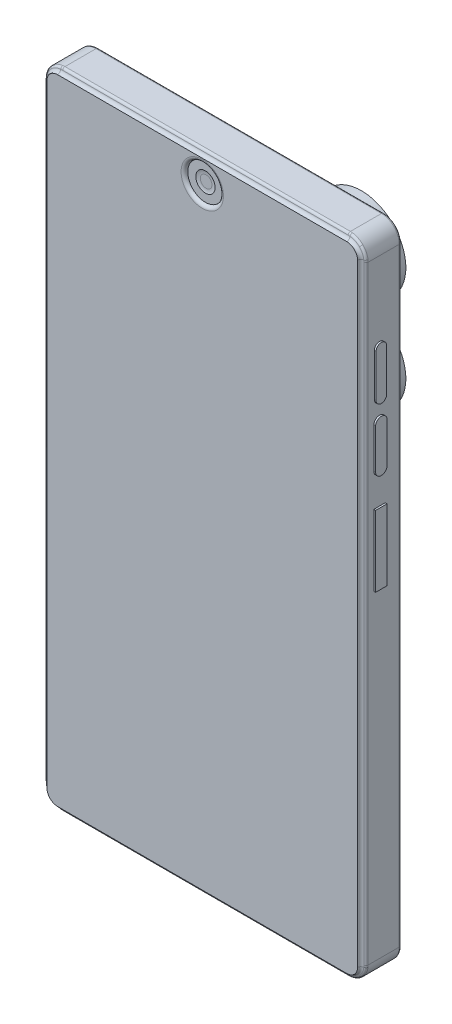
from build123d import *

# Parameters (mm, degrees)
SKETCH1_W           = 90.237490552
SKETCH1_H           = 181.084693878
BOSS_EXTRUDE1_DEPTH = 10
FILLET1_R           = 5
CUT_EXTRUDE3_DEPTH  = 1
SKETCH3_R           = 5
SKETCH3_R_2         = 12.5
SKETCH3_R_3         = 8.56802746
BOSS_EXTRUDE2_DEPTH = 4
SKETCH4_R           = 2.900185943
CUT_EXTRUDE4_DEPTH  = 1
SKETCH5_R           = 12
CUT_EXTRUDE5_DEPTH  = 1
SKETCH6_R           = 8.334390311
SKETCH6_R_2         = 6.081755444
CUT_EXTRUDE7_DEPTH  = 3
SKETCH8_W           = 87.308558364
SKETCH8_H           = 178.15576169
BOSS_EXTRUDE3_DEPTH = 0.9
FILLET2_R           = 3
SKETCH9_R           = 4.957770877
CUT_EXTRUDE8_DEPTH  = 0.9
SKETCH10_W          = 3.235977558
SKETCH10_H          = 19.955194939
BOSS_EXTRUDE4_DEPTH = 0.5
BOSS_EXTRUDE5_DEPTH = 0.5
SKETCH12_R          = 0.637732123
CUT_EXTRUDE9_DEPTH  = 6.5
SKETCH13_R          = 2.989908486
CUT_EXTRUDE10_DEPTH = 15.5
SKETCH18_R          = 2.716365736
CUT_EXTRUDE12_DEPTH = 0.2
FILLET4_R           = 3
FILLET5_R           = 1
FILLET6_R           = 1
FILLET7_R           = 1
FILLET8_R           = 1
FILLET9_R           = 1
FILLET10_R          = 1
FILLET11_R          = 1
FILLET12_R          = 1
FILLET13_R          = 1
FILLET15_R          = 0.65


# Some blends are built 0.0001 mm under size
with BuildPart() as part:
    # Sketch1 → Boss-Extrude1 (new body)
    with BuildSketch(Plane.XY):
        Rectangle(SKETCH1_W, SKETCH1_H)
    extrude(amount=BOSS_EXTRUDE1_DEPTH)

    # Fillet1
    fillet1_edges = [part.edges().sort_by_distance(p)[0] for p in [
        (45.118745276, -90.542346939, 5),
        (-45.118745276, -90.542346939, 5),
        (-45.118745276, 90.542346939, 5),
        (45.118745276, 90.542346939, 5),
    ]]
    fillet(fillet1_edges, radius=FILLET1_R)

    # Sketch2 → Cut-Extrude3 (cut)
    with BuildSketch(Plane(origin=(0, 0, 0), x_dir=(-1, 0, 0), z_dir=(0, 0, -1))):
        with BuildLine():
            Line((-16.762311283, 76.140668202), (-16.762311283, 22.728557672))
            ThreePointArc((-16.762311283, 22.728557672), (-29.831231945, 9.659637011), (-42.900152607, 22.728557672))
            Line((-42.900152607, 22.728557672), (-42.900152607, 76.140668202))
            ThreePointArc((-42.900152607, 76.140668202), (-29.831231945, 89.209588864), (-16.762311283, 76.140668202))
        make_face()
    extrude(amount=-CUT_EXTRUDE3_DEPTH, mode=Mode.SUBTRACT)

    # Sketch3 → Boss-Extrude2 (add)
    with BuildSketch(Plane(origin=(0, 0, 0), x_dir=(-1, 0, 0), z_dir=(0, 0, -1))):
        with Locations(Location((-9.659637011, 75.28834729, 0), (0, 0, 180))):
            Circle(SKETCH3_R)
        with Locations((-29.831231945, 76.140668202)):
            Circle(SKETCH3_R_2)
        with Locations((-29.831231945, 49.150505966)):
            Circle(SKETCH3_R_2)
        with Locations((-29.831231945, 22.728557672)):
            Circle(SKETCH3_R_3)
    extrude(amount=BOSS_EXTRUDE2_DEPTH)


with BuildPart() as boss_extrude2_piece_1:
    # of the separate pieces the step leaves, piece 1, a body of its own (boss_extrude2_pieces)
    add(part.part.solids().sort_by_distance((-40.118745276, 90.542346939, 0))[0])

    # Sketch4 → Cut-Extrude4 (cut)
    with BuildSketch(Plane(origin=(0, 0, -4), x_dir=(-1, 0, 0), z_dir=(0, 0, -1))):
        with Locations((-9.659637011, 75.28834729)):
            Circle(SKETCH4_R)
    extrude(amount=-CUT_EXTRUDE4_DEPTH, mode=Mode.SUBTRACT)

    # Sketch8 → Boss-Extrude3 (add)
    with BuildSketch(Plane.XY.offset(10)):
        Rectangle(SKETCH8_W, SKETCH8_H)
    extrude(amount=BOSS_EXTRUDE3_DEPTH)

    # Fillet2
    fillet2_edges = [boss_extrude2_piece_1.edges().sort_by_distance(p)[0] for p in [
        (-43.654279182, 89.077880845, 10.45),
        (-43.654279182, -89.077880845, 10.45),
        (43.654279182, -89.077880845, 10.45),
        (43.654279182, 89.077880845, 10.45),
    ]]
    fillet(fillet2_edges, radius=FILLET2_R)

    # Sketch9 → Cut-Extrude8 (cut)
    with BuildSketch(Plane.XY.offset(10.9)):
        with Locations((0, 82.824262903)):
            Circle(SKETCH9_R)
    extrude(amount=-CUT_EXTRUDE8_DEPTH, mode=Mode.SUBTRACT)

    # Sketch10 → Boss-Extrude4 (add)
    with BuildSketch(Plane(origin=(45.118745276, 0, 0), x_dir=(0, 0, -1), z_dir=(1, 0, 0))):
        with BuildLine():
            Line((-4.691196324, 63.18261204), (-4.691196324, 51.28261204))
            ThreePointArc((-4.691196324, 51.28261204), (-6.174352705, 49.79945566), (-7.657509086, 51.28261204))
            Line((-7.657509086, 51.28261204), (-7.657509086, 63.18261204))
            ThreePointArc((-7.657509086, 63.18261204), (-6.174352705, 64.665768421), (-4.691196324, 63.18261204))
        make_face()
        with BuildLine():
            Line((-4.556363926, 45.080321721), (-4.556363926, 33.889232668))
            ThreePointArc((-4.556363926, 33.889232668), (-6.174352705, 32.271243889), (-7.792341484, 33.889232668))
            Line((-7.792341484, 33.889232668), (-7.792341484, 45.080321721))
            ThreePointArc((-7.792341484, 45.080321721), (-6.174352705, 46.6983105), (-4.556363926, 45.080321721))
        make_face()
        with Locations((-6.174352705, 14.608199721)):
            Rectangle(SKETCH10_W, SKETCH10_H)
    extrude(amount=BOSS_EXTRUDE4_DEPTH)

    # Sketch11 → Boss-Extrude5 (add)
    with BuildSketch(Plane.ZY.offset(45.118745276)):
        with BuildLine():
            Line((6.796737289, 77.714567973), (6.796737289, 52.600714976))
            ThreePointArc((6.796737289, 52.600714976), (5, 50.803977687), (3.203262711, 52.600714976))
            Line((3.203262711, 52.600714976), (3.203262711, 77.714567973))
            ThreePointArc((3.203262711, 77.714567973), (5, 79.511305262), (6.796737289, 77.714567973))
        make_face()
    extrude(amount=BOSS_EXTRUDE5_DEPTH)

    # Sketch12 → Cut-Extrude9 (cut)
    with BuildSketch(Plane.ZY.offset(45.618745276)):
        with Locations((5.044499855, 77.788308476)):
            Circle(SKETCH12_R)
    extrude(amount=-CUT_EXTRUDE9_DEPTH, mode=Mode.SUBTRACT)

    # Sketch13 → Cut-Extrude10 (cut)
    with BuildSketch(Plane.XZ.offset(90.542346939)):
        with Locations(Location((20.888479318, 5, 0), (0, 0, 270))):
            Circle(SKETCH13_R)
        with BuildLine():
            Line((-7.922100204, 6.862023651), (4.390113267, 6.862023651))
            ThreePointArc((4.390113267, 6.862023651), (6.252136918, 5), (4.390113267, 3.137976349))
            Line((4.390113267, 3.137976349), (-7.922100204, 3.137976349))
            ThreePointArc((-7.922100204, 3.137976349), (-9.784123855, 5), (-7.922100204, 6.862023651))
        make_face()
    extrude(amount=-CUT_EXTRUDE10_DEPTH, mode=Mode.SUBTRACT)

    # Sketch18 → Cut-Extrude12 (cut)
    with BuildSketch(Plane.XY.offset(10)):
        with Locations((0, 82.824262903)):
            Circle(SKETCH18_R)
    extrude(amount=-CUT_EXTRUDE12_DEPTH, mode=Mode.SUBTRACT)

    # Fillet4
    # the kernel refuses this fillet: 3 mm, written as the material it adds along each edge
    with BuildSketch(Plane(origin=(0, 82.824262903, 9.8), x_dir=(1, 0, 0), z_dir=(0, -1, 0))) as fillet4_piece_1:
        with BuildLine():
            CenterArc((1.639332775, 3), FILLET4_R, 270, 21.039469781)
            Line((1.639332775, 0), (1.639332775, -0.06))
            Line((1.639332775, -0.06), (2.716365736, -0.06))
            Line((2.716365736, -0.06), (2.776365736, 0))
            ThreePointArc((2.776365736, 0), (2.776365736, 0.1), (2.737906395, 0.144))
            Line((2.737906395, 0.144), (2.716365736, 0.2))
        make_face()
    revolve(axis=Axis((0, 82.824262903, 9.8), (0, 0, 1)))

    # Fillet5
    # the kernel refuses this fillet: 1 mm, written as the material it takes off along each edge
    with BuildSketch(Plane(origin=(0, 82.824262903, 10.9), x_dir=(1, 0, 0), z_dir=(0, -1, 0))) as fillet5_piece_1:
        with BuildLine():
            CenterArc((5.952758314, -1), FILLET5_R, 90, 84.260829523)
            Line((5.952758314, 0), (5.952758314, 0.02))
            Line((5.952758314, 0.02), (4.957770877, 0.02))
            Line((4.957770877, 0.02), (4.937770877, 0))
            ThreePointArc((4.937770877, 0), (4.937770877, -0.45), (4.937871128, -0.898))
            Line((4.937871128, -0.898), (4.957770877, -0.9))
        make_face()
    revolve(axis=Axis((0, 82.824262903, 10.9), (0, 0, 1)), mode=Mode.SUBTRACT)

    # Fillet11
    fillet11_edges = [boss_extrude2_piece_1.edges().sort_by_distance(p)[0] for p in [
        (4.659637011, 75.28834729, 0),
        (12.559822954, 75.28834729, -4),
    ]]
    fillet(fillet11_edges, radius=FILLET11_R - 0.0001)  # a hair under: the kernel refuses the full size

    # Fillet12
    fillet12_edges = [boss_extrude2_piece_1.edges().sort_by_distance(p)[0] for p in [
        (29.831231945, 89.209588864, 1),
        (42.900152607, 49.434612937, 1),
        (29.831231945, 9.659637011, 1),
        (16.762311283, 49.434612937, 1),
    ]]
    fillet(fillet12_edges, radius=FILLET12_R - 0.0001)  # a hair under: the kernel refuses the full size

    # Fillet13
    # the kernel refuses this fillet: 1 mm, written as the material it adds along each edge
    with BuildSketch(Plane(origin=(-40.654279182, 86.077880845, 10), x_dir=(0, 1, 0), z_dir=(1, 0, 0))) as fillet13_piece_1:
        with BuildLine():
            CenterArc((3.994987437, 1), FILLET13_R, 185.739170477, 84.260829523)
            Line((3, 0.9), (2.980100251, 0.898))
            ThreePointArc((2.980100251, 0.898), (2.98, 0.45), (2.98, 0))
            Line((2.98, 0), (3, -0.02))
            Line((3, -0.02), (3.994987437, -0.02))
            Line((3.994987437, -0.02), (3.994987437, 0))
        make_face()
    revolve(axis=Axis((-40.654279182, 86.077880845, 10), (0, 0, 1)), revolution_arc=90)
    with BuildSketch(Plane(origin=(-40.654279182, 89.077880845, 10), x_dir=(0, 1, 0), z_dir=(1, 0, 0)), Plane(origin=(40.654279182, -89.077880845, 10), x_dir=(0, -1, 0), z_dir=(-1, 0, 0))) as fillet13_piece_2:
        with BuildLine():
            CenterArc((0.994987437, 1), FILLET13_R, 185.739170477, 84.260829523)
            Line((0, 0.9), (-0.019899749, 0.898))
            ThreePointArc((-0.019899749, 0.898), (-0.02, 0.45), (-0.02, 0))
            Line((-0.02, 0), (0, -0.02))
            Line((0, -0.02), (0.994987437, -0.02))
            Line((0.994987437, -0.02), (0.994987437, 0))
        make_face()
    extrude(amount=81.308558364)
    with BuildSketch(Plane(origin=(40.654279182, 86.077880845, 10), x_dir=(0, 1, 0), z_dir=(-1, 0, 0))) as fillet13_piece_3:
        with BuildLine():
            CenterArc((3.994987437, -1), FILLET13_R, 90, 84.260829523)
            Line((3, -0.9), (2.980100251, -0.898))
            ThreePointArc((2.980100251, -0.898), (2.98, -0.45), (2.98, 0))
            Line((2.98, 0), (3, 0.02))
            Line((3, 0.02), (3.994987437, 0.02))
            Line((3.994987437, 0.02), (3.994987437, 0))
        make_face()
    revolve(axis=Axis((40.654279182, 86.077880845, 10), (0, 0, -1)), revolution_arc=90)
    with BuildSketch(Plane(origin=(43.654279182, 86.077880845, 10), x_dir=(1, 0, 0), z_dir=(0, -1, 0)), Plane(origin=(-43.654279182, -86.077880845, 10), x_dir=(-1, 0, 0), z_dir=(0, 1, 0))) as fillet13_piece_4:
        with BuildLine():
            CenterArc((0.994987437, 1), FILLET13_R, 185.739170477, 84.260829523)
            Line((0, 0.9), (-0.019899749, 0.898))
            ThreePointArc((-0.019899749, 0.898), (-0.02, 0.45), (-0.02, 0))
            Line((-0.02, 0), (0, -0.02))
            Line((0, -0.02), (0.994987437, -0.02))
            Line((0.994987437, -0.02), (0.994987437, 0))
        make_face()
    extrude(amount=172.155761689)
    with BuildSketch(Plane(origin=(40.654279182, -86.077880845, 10), x_dir=(1, 0, 0), z_dir=(0, 1, 0))) as fillet13_piece_5:
        with BuildLine():
            CenterArc((3.994987437, -1), FILLET13_R, 90, 84.260829523)
            Line((3, -0.9), (2.980100251, -0.898))
            ThreePointArc((2.980100251, -0.898), (2.98, -0.45), (2.98, 0))
            Line((2.98, 0), (3, 0.02))
            Line((3, 0.02), (3.994987437, 0.02))
            Line((3.994987437, 0.02), (3.994987437, 0))
        make_face()
    revolve(axis=Axis((40.654279182, -86.077880845, 10), (0, 0, -1)), revolution_arc=90)
    with BuildSketch(Plane(origin=(-40.654279182, -86.077880845, 10), x_dir=(-1, 0, 0), z_dir=(0, 1, 0))) as fillet13_piece_6:
        with BuildLine():
            CenterArc((3.994987437, 1), FILLET13_R, 185.739170477, 84.260829523)
            Line((3, 0.9), (2.980100251, 0.898))
            ThreePointArc((2.980100251, 0.898), (2.98, 0.45), (2.98, 0))
            Line((2.98, 0), (3, -0.02))
            Line((3, -0.02), (3.994987437, -0.02))
            Line((3.994987437, -0.02), (3.994987437, 0))
        make_face()
    revolve(axis=Axis((-40.654279182, -86.077880845, 10), (0, 0, 1)), revolution_arc=90)

    # Fillet15
    fillet15_edges = [boss_extrude2_piece_1.edges().sort_by_distance(p)[0] for p in [
        (43.654258651, -89.077860314, 10),
        (43.654258651, -89.077860314, 10),
        (0, -90.542346939, 10),
        (-43.654258651, -89.077860314, 10),
        (-43.654258651, -89.077860314, 10),
        (-45.118745276, 0, 10),
        (-43.654258651, 89.077860314, 10),
        (-43.654258651, 89.077860314, 10),
        (0, 90.542346939, 10),
        (43.654258651, 89.077860314, 10),
        (43.654258651, 89.077860314, 10),
        (43.654279182, -89.077880845, 0),
        (0, -90.542346939, 0),
        (-43.654279182, -89.077880845, 0),
        (-45.118745276, 0, 0),
        (-43.654279182, 89.077880845, 0),
        (0, 90.542346939, 0),
        (43.654279182, 89.077880845, 0),
        (45.118745276, 0, 10),
        (45.118745276, 0, 0),
    ]]
    fillet(fillet15_edges, radius=FILLET15_R)


with BuildPart() as boss_extrude2_piece_2:
    # of the separate pieces the step leaves, piece 2, a body of its own (boss_extrude2_pieces)
    add(part.part.solids().sort_by_distance((17.331231945, 49.150505966, 0))[0])


with BuildPart() as boss_extrude2_piece_3:
    # of the separate pieces the step leaves, piece 3, a body of its own (boss_extrude2_pieces)
    add(part.part.solids().sort_by_distance((17.331231945, 76.140668202, 0))[0])


with BuildPart() as boss_extrude2_piece_4:
    # of the separate pieces the step leaves, piece 4, a body of its own (boss_extrude2_pieces)
    add(part.part.solids().sort_by_distance((21.263204485, 22.728557672, 0))[0])

    # Sketch6 → Cut-Extrude7 (cut)
    with BuildSketch(Plane(origin=(0, 0, -4), x_dir=(-1, 0, 0), z_dir=(0, 0, -1))):
        with Locations((-29.831231945, 22.728557672)):
            Circle(SKETCH6_R)
        with Locations((-29.831231945, 22.728557672)):
            Circle(SKETCH6_R_2, mode=Mode.SUBTRACT)
    extrude(amount=-CUT_EXTRUDE7_DEPTH, mode=Mode.SUBTRACT)

    # Fillet6
    fillet6_edges = [boss_extrude2_piece_4.edges().sort_by_distance(p)[0] for p in [
        (35.912987389, 22.728557672, -4),
        (35.912987389, 22.728557672, -1),
    ]]
    fillet(fillet6_edges, radius=FILLET6_R)

    # Fillet7
    # the kernel refuses this fillet: 1 mm, written as the material it takes off along each edge
    with BuildSketch(Plane(origin=(29.831231945, 22.728557672, 0), x_dir=(-1, 0, 0), z_dir=(0, -1, 0))) as fillet7_piece_1:
        with BuildLine():
            CenterArc((8.56802746 - FILLET7_R, FILLET7_R), FILLET7_R, 270, 90)
            Line((8.56802746 - FILLET7_R, 0), (8.56802746 - FILLET7_R, -FILLET7_R * 0.02))
            Line((8.56802746 - FILLET7_R, -FILLET7_R * 0.02), (8.56802746 + FILLET7_R * 0.02, -FILLET7_R * 0.02))
            Line((8.56802746 + FILLET7_R * 0.02, -FILLET7_R * 0.02), (8.56802746 + FILLET7_R * 0.02, FILLET7_R))
            Line((8.56802746 + FILLET7_R * 0.02, FILLET7_R), (8.56802746, FILLET7_R))
        make_face()
    revolve(axis=Axis((29.831231945, 22.728557672, 0), (0, 0, -1)), mode=Mode.SUBTRACT)
    with BuildSketch(Plane(origin=(29.831231945, 22.728557672, -4), x_dir=(-1, 0, 0), z_dir=(0, -1, 0))) as fillet7_piece_2:
        with BuildLine():
            CenterArc((7.56802746, -0.642407955), FILLET7_R, 0, 39.971609887)
            Line((8.56802746, -0.642407955), (8.58802746, -0.642407955))
            Line((8.58802746, -0.642407955), (8.58802746, 0))
            Line((8.58802746, 0), (8.56802746, 0.02))
            ThreePointArc((8.56802746, 0.02), (8.451208885, 0.02), (8.349717568, 0.012848159))
            Line((8.349717568, 0.012848159), (8.334390311, 0))
        make_face()
    revolve(axis=Axis((29.831231945, 22.728557672, -4), (0, 0, -1)), mode=Mode.SUBTRACT)


with BuildPart() as cut_extrude5_tool:
    # Sketch5 → Cut-Extrude5 (new body)
    with BuildSketch(Plane(origin=(0, 0, -4), x_dir=(-1, 0, 0), z_dir=(0, 0, -1))):
        with Locations((-29.805405551, 76.085694229)):
            Circle(SKETCH5_R)
        with Locations((-29.831231945, 49.150505966)):
            Circle(SKETCH5_R)
    extrude(amount=-CUT_EXTRUDE5_DEPTH)


with BuildPart() as boss_extrude2_piece_2_1:
    add(boss_extrude2_piece_2.part)

    # Cut-Extrude5: cut by cut_extrude5_tool
    add(cut_extrude5_tool.part, mode=Mode.SUBTRACT)

    # Fillet8
    fillet8_edges = [boss_extrude2_piece_2_1.edges().sort_by_distance(p)[0] for p in [
        (42.331231945, 49.150505966, 0),
    ]]
    fillet(fillet8_edges, radius=FILLET8_R)

    # Fillet10
    fillet10_edges = [boss_extrude2_piece_2_1.edges().sort_by_distance(p)[0] for p in [
        (41.831231945, 49.150505966, -3),
    ]]
    fillet(fillet10_edges, radius=FILLET10_R - 0.0001)  # a hair under: the kernel refuses the full size


with BuildPart() as boss_extrude2_piece_3_1:
    add(boss_extrude2_piece_3.part)

    # Cut-Extrude5: cut by cut_extrude5_tool
    add(cut_extrude5_tool.part, mode=Mode.SUBTRACT)

    # Fillet9
    fillet9_edges = [boss_extrude2_piece_3_1.edges().sort_by_distance(p)[0] for p in [
        (41.805405551, 76.085694229, -3),
    ]]
    fillet(fillet9_edges, radius=FILLET9_R - 0.0001)  # a hair under: the kernel refuses the full size


solid = Compound([boss_extrude2_piece_1.part, boss_extrude2_piece_4.part, boss_extrude2_piece_2_1.part, boss_extrude2_piece_3_1.part])
